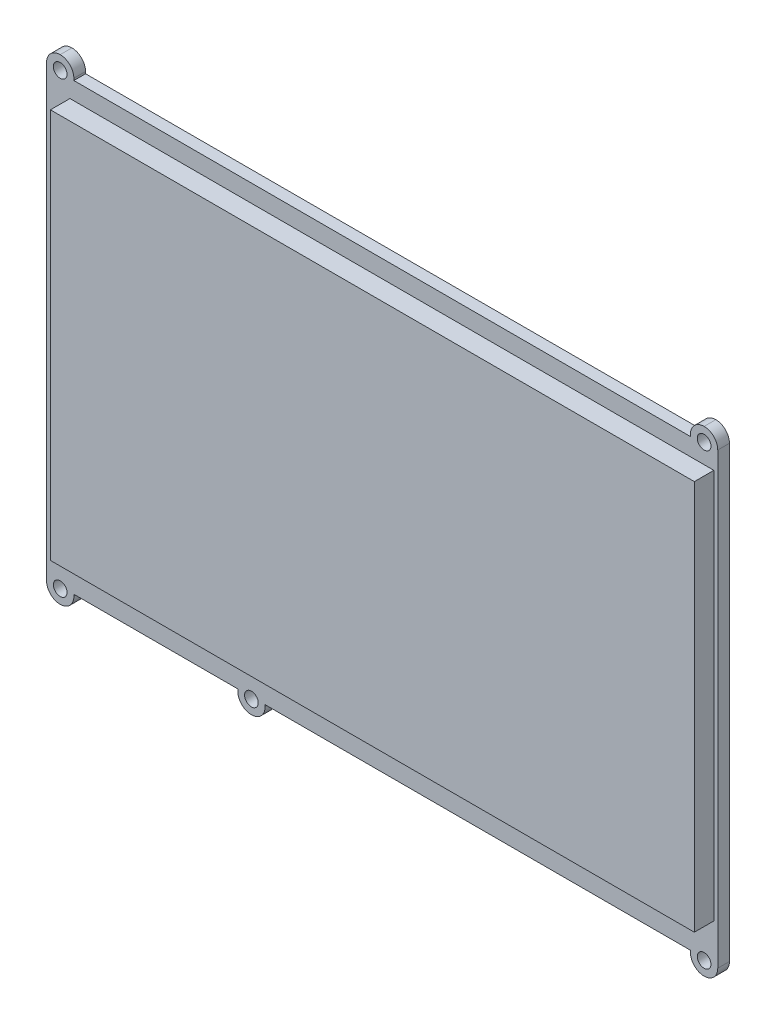
from build123d import *

# Parameters (mm, degrees)
SKETCH1_W           = 165
SKETCH1_H           = 100
BOSS_EXTRUDE1_DEPTH = 8
SKETCH1_4_R         = 1.75
SKETCH1_4_R_2       = 1.742752204
SKETCH1_4_W         = 165
SKETCH1_4_H         = 100
BOSS_EXTRUDE2_DEPTH = 3
FILLET3_R           = 3.5


with BuildPart() as part:
    # Sketch1 → Boss-Extrude1 (new body)
    with BuildSketch(Plane.XY):
        with Locations((88.5, 63.5)):
            Rectangle(SKETCH1_W, SKETCH1_H)
    extrude(amount=BOSS_EXTRUDE1_DEPTH)

    # Sketch1<4> → Boss-Extrude2 (add)
    with BuildSketch(Plane.XY):
        Polygon((7, 122), (7, 118), (165, 118), (165, 122), (172, 122), (172, 0), (165, 0), (165, 4), (56, 4), (56, 0), (49, 0), (49, 4), (7, 4), (7, 0), (0, 0), (0, 122), align=None)
        with Locations((3.5, 118.5)):
            Circle(SKETCH1_4_R, mode=Mode.SUBTRACT)
        with Locations((168.5, 118.5)):
            Circle(SKETCH1_4_R, mode=Mode.SUBTRACT)
        with Locations((168.5, 3.5)):
            Circle(SKETCH1_4_R, mode=Mode.SUBTRACT)
        with Locations((3.5, 3.5)):
            Circle(SKETCH1_4_R, mode=Mode.SUBTRACT)
        with Locations((52.5, 3.5)):
            Circle(SKETCH1_4_R, mode=Mode.SUBTRACT)
        with Locations((3.5, 61.5)):
            Circle(SKETCH1_4_R_2, mode=Mode.SUBTRACT)
        with Locations((88.5, 63.5)):
            Rectangle(SKETCH1_4_W, SKETCH1_4_H, mode=Mode.SUBTRACT)
    extrude(amount=BOSS_EXTRUDE2_DEPTH)

    # Fillet3
    fillet3_edges = [part.edges().sort_by_distance(p)[0] for p in [
        (56, 0, 1.5),
        (165, 0, 1.5),
        (172, 0, 1.5),
        (49, 0, 1.5),
        (0, 0, 1.5),
        (7, 0, 1.5),
        (0, 122, 1.5),
        (7, 122, 1.5),
        (172, 122, 1.5),
        (165, 122, 1.5),
    ]]
    fillet(fillet3_edges, radius=FILLET3_R - 0.0001)  # a hair under: the kernel refuses the full size


solid = part.part
